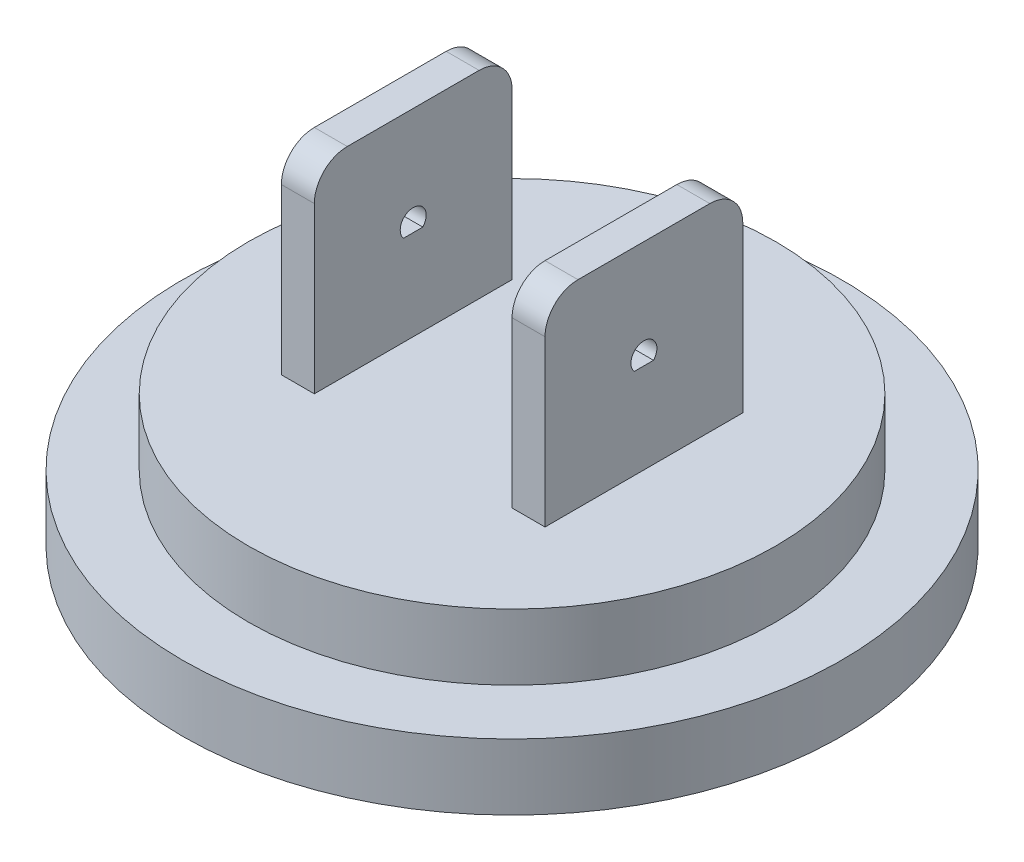
from build123d import *

# Parameters (mm, degrees)
SKETCH2_R           = 63.5
BOSS_EXTRUDE1_DEPTH = 12.7
SKETCH3_R           = 50.8
BOSS_EXTRUDE2_DEPTH = 12.7
SKETCH4_R           = 6.35
BOSS_EXTRUDE3_DEPTH = 25.4
SKETCH5_W           = 6.35
SKETCH5_H           = 38.1
BOSS_EXTRUDE4_DEPTH = 38.1
FILLET1_R           = 6.35
CUT_EXTRUDE1_DEPTH  = 127.363404513
CUT_EXTRUDE2_START  = -12.7
CUT_EXTRUDE2_DEPTH  = 12.7
CIRPATTERN1_COUNT   = 28


with BuildPart() as part:
    # Sketch2 → Boss-Extrude1 (new body)
    with BuildSketch(Plane(origin=(0, 0, 0), x_dir=(1, 0, 0), z_dir=(0, 1, 0))):
        Circle(SKETCH2_R)
    extrude(amount=BOSS_EXTRUDE1_DEPTH)

    # Sketch3 → Boss-Extrude2 (add)
    with BuildSketch(Plane(origin=(0, 12.7, 0), x_dir=(1, 0, 0), z_dir=(0, 1, 0))):
        Circle(SKETCH3_R)
    extrude(amount=BOSS_EXTRUDE2_DEPTH)

    # Sketch4 → Boss-Extrude3 (add)
    with BuildSketch(Plane.XZ):
        Circle(SKETCH4_R)
    extrude(amount=BOSS_EXTRUDE3_DEPTH)

    # Sketch5 → Boss-Extrude4 (add)
    with BuildSketch(Plane(origin=(0, 25.4, 0), x_dir=(1, 0, 0), z_dir=(0, 1, 0))):
        with Locations((22.225, 0)):
            Rectangle(SKETCH5_W, SKETCH5_H)
        with Locations((-22.225, 0)):
            Rectangle(SKETCH5_W, SKETCH5_H)
    extrude(amount=BOSS_EXTRUDE4_DEPTH)

    # Fillet1
    fillet1_edges = [part.edges().sort_by_distance(p)[0] for p in [
        (22.225, 63.5, 19.05),
        (-22.225, 63.5, 19.05),
        (22.225, 63.5, -19.05),
        (-22.225, 63.5, -19.05),
    ]]
    fillet(fillet1_edges, radius=FILLET1_R)

    # Sketch6 → Cut-Extrude1 (cut, through all)
    with BuildSketch(Plane.ZY.offset(25.4)):
        with BuildLine():
            Line((-1.855488288, 42.77170717), (1.855488288, 42.77170717))
            ThreePointArc((1.855488288, 42.77170717), (0, 46.9519), (-1.855488288, 42.77170717))
        make_face()
    extrude(amount=-CUT_EXTRUDE1_DEPTH, mode=Mode.SUBTRACT)

    # Sketch7 → Cut-Extrude2 (cut)
    with BuildSketch(Plane.XZ.offset(25.4).offset(CUT_EXTRUDE2_START)):
        with BuildLine():
            Line((0, 5.08), (0.710231041, 6.310156248))
            ThreePointArc((0.710231041, 6.310156248), (0, 6.35), (-0.710231041, 6.310156248))
            Line((-0.710231041, 6.310156248), (0, 5.08))
        make_face()
    cut_extrude2 = extrude(amount=CUT_EXTRUDE2_DEPTH, mode=Mode.SUBTRACT)

    # CirPattern1: Cut-Extrude2 ×28 about axis
    cirpattern1_axis = Axis((0, -25.4, 0), (0, 1, 0))
    for i in range(1, CIRPATTERN1_COUNT):
        add(cut_extrude2.rotate(cirpattern1_axis, i * 360 / CIRPATTERN1_COUNT), mode=Mode.SUBTRACT)


solid = part.part
